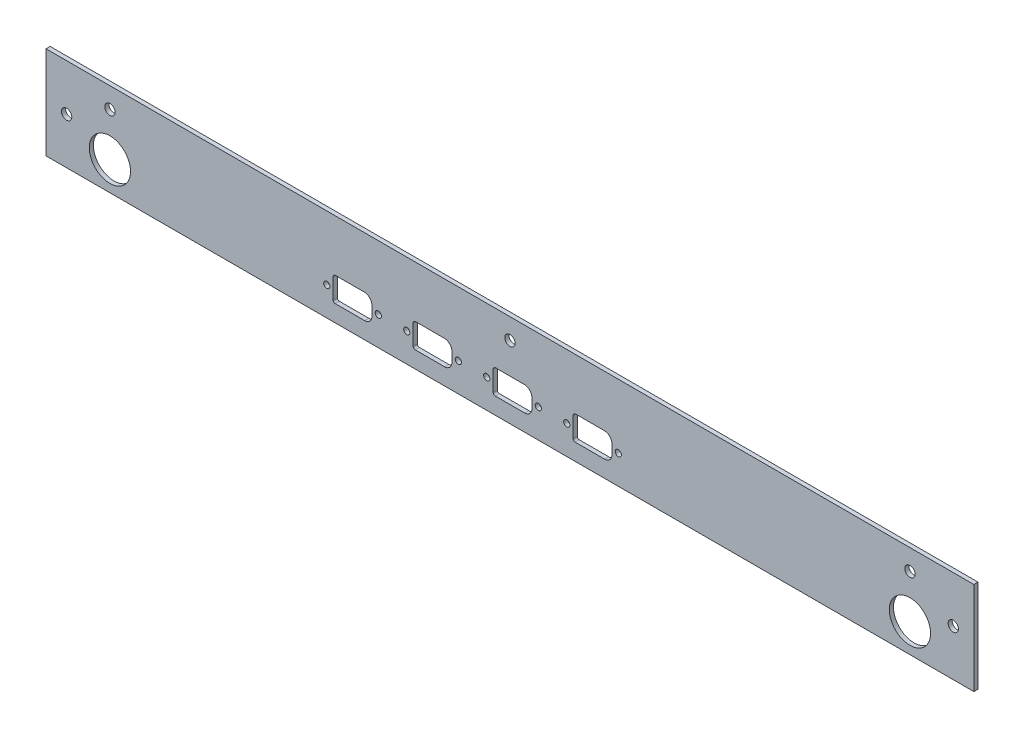
from build123d import *

# Parameters (mm, degrees)
SKETCH1_W           = 450
SKETCH1_H           = 45
BOSS_EXTRUDE1_DEPTH = 2
SKETCH2_R           = 1.5
CUT_EXTRUDE1_DEPTH  = 227.131046077
SKETCH3_R           = 2.5
CUT_EXTRUDE2_DEPTH  = 227.131046077
SKETCH4_R           = 10
CUT_EXTRUDE3_DEPTH  = 10


with BuildPart() as part:
    # Sketch1 → Boss-Extrude1 (new body)
    with BuildSketch(Plane.XY):
        Rectangle(SKETCH1_W, SKETCH1_H)
    extrude(amount=BOSS_EXTRUDE1_DEPTH)

    # Sketch2 → Cut-Extrude1 (cut, through all)
    with BuildSketch(Plane.XY.offset(2)):
        with Locations((-50.0375, -8.55)):
            Circle(SKETCH2_R)
        with Locations((-25.0375, -8.55)):
            Circle(SKETCH2_R)
        with Locations((-11.2375, -8.55)):
            Circle(SKETCH2_R)
        with Locations((13.7625, -8.55)):
            Circle(SKETCH2_R)
        with Locations((27.5625, -8.55)):
            Circle(SKETCH2_R)
        with Locations((52.5625, -8.55)):
            Circle(SKETCH2_R)
        with Locations((-88.8375, -8.55)):
            Circle(SKETCH2_R)
        with Locations((-63.8375, -8.55)):
            Circle(SKETCH2_R)
        with BuildLine():
            Line((-31.6625, -14.4), (-45.9375, -14.4))
            ThreePointArc((-45.9375, -14.4), (-46.644606781, -14.107106781), (-46.9375, -13.4))
            Line((-46.9375, -13.4), (-46.9375, -3.7))
            ThreePointArc((-46.9375, -3.7), (-46.586028137, -2.851471863), (-45.7375, -2.5))
            Line((-45.7375, -2.5), (-31.8625, -2.5))
            ThreePointArc((-31.8625, -2.5), (-29.22852724, -3.59102724), (-28.1375, -6.225))
            Line((-28.1375, -6.225), (-28.1375, -10.875))
            ThreePointArc((-28.1375, -10.875), (-29.169948596, -13.367551404), (-31.6625, -14.4))
        make_face()
        with BuildLine():
            Line((7.1375, -14.4), (-7.1375, -14.4))
            ThreePointArc((-7.1375, -14.4), (-7.844606781, -14.107106781), (-8.1375, -13.4))
            Line((-8.1375, -13.4), (-8.1375, -3.7))
            ThreePointArc((-8.1375, -3.7), (-7.786028137, -2.851471863), (-6.9375, -2.5))
            Line((-6.9375, -2.5), (6.9375, -2.5))
            ThreePointArc((6.9375, -2.5), (9.57147276, -3.59102724), (10.6625, -6.225))
            Line((10.6625, -6.225), (10.6625, -10.875))
            ThreePointArc((10.6625, -10.875), (9.630051404, -13.367551404), (7.1375, -14.4))
        make_face()
        with BuildLine():
            Line((45.9375, -14.4), (31.6625, -14.4))
            ThreePointArc((31.6625, -14.4), (30.955393219, -14.107106781), (30.6625, -13.4))
            Line((30.6625, -13.4), (30.6625, -3.7))
            ThreePointArc((30.6625, -3.7), (31.013971863, -2.851471863), (31.8625, -2.5))
            Line((31.8625, -2.5), (45.7375, -2.5))
            ThreePointArc((45.7375, -2.5), (48.37147276, -3.59102724), (49.4625, -6.225))
            Line((49.4625, -6.225), (49.4625, -10.875))
            ThreePointArc((49.4625, -10.875), (48.430051404, -13.367551404), (45.9375, -14.4))
        make_face()
        with BuildLine():
            Line((-70.4625, -14.4), (-84.7375, -14.4))
            ThreePointArc((-84.7375, -14.4), (-85.444606781, -14.107106781), (-85.7375, -13.4))
            Line((-85.7375, -13.4), (-85.7375, -3.7))
            ThreePointArc((-85.7375, -3.7), (-85.386028137, -2.851471863), (-84.5375, -2.5))
            Line((-84.5375, -2.5), (-70.6625, -2.5))
            ThreePointArc((-70.6625, -2.5), (-68.02852724, -3.59102724), (-66.9375, -6.225))
            Line((-66.9375, -6.225), (-66.9375, -10.875))
            ThreePointArc((-66.9375, -10.875), (-67.969948596, -13.367551404), (-70.4625, -14.4))
        make_face()
    extrude(amount=-CUT_EXTRUDE1_DEPTH, mode=Mode.SUBTRACT)

    # Sketch3 → Cut-Extrude2 (cut, through all)
    with BuildSketch(Plane.XY.offset(2)):
        with Locations((-215, 0)):
            Circle(SKETCH3_R)
        with Locations((215, 0)):
            Circle(SKETCH3_R)
        with Locations((-194, 12.495407459)):
            Circle(SKETCH3_R)
        with Locations((194, 12.495407459)):
            Circle(SKETCH3_R)
        with Locations((0, 12.5)):
            Circle(SKETCH3_R)
    extrude(amount=-CUT_EXTRUDE2_DEPTH, mode=Mode.SUBTRACT)

    # Sketch4 → Cut-Extrude3 (cut)
    with BuildSketch(Plane.XY.offset(2)):
        with Locations((-194, -8.55)):
            Circle(SKETCH4_R)
        with Locations((194, -8.55)):
            Circle(SKETCH4_R)
    extrude(amount=-CUT_EXTRUDE3_DEPTH, mode=Mode.SUBTRACT)


solid = part.part
